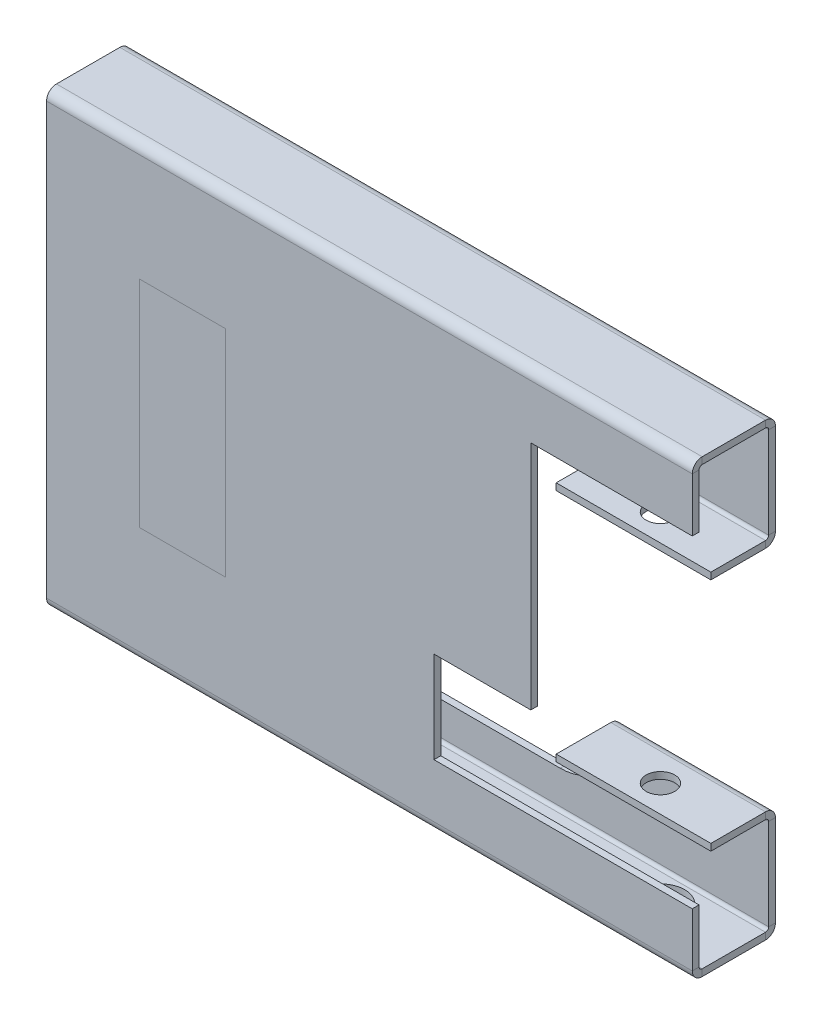
from build123d import *

# Parameters (mm, degrees)
SKETCH1_W                      = 152.4
SKETCH1_H                      = 101.6
BASE_FLANGE1_DEPTH             = 1.6002
EDGE_FLANGE1_DEPTH             = 152.4
EDGE_FLANGE2_DEPTH             = 152.4
CUT_EXTRUDE1_DEPTH             = 95.949783169
EDGE_FLANGE7_STRIP_W           = 7.874
EDGE_FLANGE7_STRIP_H           = 1.6002
EDGE_FLANGE7_STRIP_CUT_DEPTH   = 152.4
EDGE_FLANGE7_DEPTH             = 152.4
EDGE_FLANGE8_STRIP_W           = 7.874
EDGE_FLANGE8_STRIP_H           = 1.6002
EDGE_FLANGE8_STRIP_CUT_DEPTH   = 152.4
EDGE_FLANGE8_DEPTH             = 152.4
SKETCH35_W                     = 36.50996
SKETCH35_H                     = 1.6002
BOSS_EXTRUDE1_DEPTH            = 16.0528
EDGE_FLANGE9_STRIP_W           = 7.874
EDGE_FLANGE9_STRIP_H           = 1.6002
EDGE_FLANGE9_STRIP_CUT_DEPTH   = 36.50996
EDGE_FLANGE9_DEPTH             = 36.50996
SKETCH39_W                     = 36.50996
SKETCH39_H                     = 1.6002
BOSS_EXTRUDE2_DEPTH            = 16.0528
EDGE_FLANGE10_STRIP_W          = 7.874
EDGE_FLANGE10_STRIP_H          = 1.6002
EDGE_FLANGE10_STRIP_CUT_DEPTH  = 36.50996
EDGE_FLANGE10_DEPTH            = 36.50996
CUT_EXTRUDE2_REACH             = 114.257
SKETCH43_R                     = 3.37312
CUT_EXTRUDE2_DIRECTION_2_REACH = 114.257
FILLET1_R                      = 12.7
CUT_EXTRUDE3_REACH             = 134.235
SKETCH46_R                     = 5.715


# Sheet-metal steps are written as plain solids
with BuildPart() as part:
    # Sketch1 → Base-Flange1 (new body)
    with BuildSketch(Plane.XY):
        Rectangle(SKETCH1_W, SKETCH1_H)
    extrude(amount=-BASE_FLANGE1_DEPTH)

    # Edge-Flange1 section (across the edge) → Edge-Flange1 (add)
    with BuildSketch(Plane(origin=(-76.2, 51.5366, -1.6002), x_dir=(0, -1, 0), z_dir=(1, 0, 0))):
        with BuildLine():
            Line((-1.6002, 0.7366), (-1.6002, 18.034))
            Line((-1.6002, 18.034), (0, 18.034))
            Line((0, 18.034), (0, 0.7366))
            ThreePointArc((0, 0.7366), (0.215745145, 0.215745145), (0.7366, 0))
            Line((0.7366, 0), (0.7366, -1.6002))
            ThreePointArc((0.7366, -1.6002), (-0.915767126, -0.915767126), (-1.6002, 0.7366))
        make_face()
    extrude(amount=EDGE_FLANGE1_DEPTH)

    # Edge-Flange2 section (across the edge) → Edge-Flange2 (add)
    with BuildSketch(Plane(origin=(76.2, -51.5366, -1.6002), x_dir=(0, 1, 0), z_dir=(-1, 0, 0))):
        with BuildLine():
            Line((-1.6002, 0.7366), (-1.6002, 18.034))
            Line((-1.6002, 18.034), (0, 18.034))
            Line((0, 18.034), (0, 0.7366))
            ThreePointArc((0, 0.7366), (0.215745145, 0.215745145), (0.7366, 0))
            Line((0.7366, 0), (0.7366, -1.6002))
            ThreePointArc((0.7366, -1.6002), (-0.915767126, -0.915767126), (-1.6002, 0.7366))
        make_face()
    extrude(amount=EDGE_FLANGE2_DEPTH)

    # Sketch14 → Cut-Extrude1 (cut, through all)
    with BuildSketch(Plane.XY):
        Polygon((76.2, -38.1), (76.2, 38.1), (38.1, 38.1), (38.1, -16.51), (15.24, -16.51), (15.24, -38.1), align=None)
    extrude(amount=-CUT_EXTRUDE1_DEPTH, mode=Mode.SUBTRACT)

    # Edge-Flange7 strip (across the edge) → Edge-Flange7 strip cut (cut)
    with BuildSketch(Plane(origin=(76.2, -51.5366, -19.6342), x_dir=(0, 0, 1), z_dir=(-1, 0, 0))):
        with Locations((-1.6002, -0.8001)):
            Rectangle(EDGE_FLANGE7_STRIP_W, EDGE_FLANGE7_STRIP_H)
    extrude(amount=EDGE_FLANGE7_STRIP_CUT_DEPTH, mode=Mode.SUBTRACT)

    # Edge-Flange7 section (across the edge) → Edge-Flange7 (add)
    with BuildSketch(Plane(origin=(76.2, -51.5366, -19.6342), x_dir=(0, 0, 1), z_dir=(-1, 0, 0))):
        with BuildLine():
            Line((0, 0.7366), (0, 8.5598))
            Line((0, 8.5598), (1.6002, 8.5598))
            Line((1.6002, 8.5598), (1.6002, 0.7366))
            ThreePointArc((1.6002, 0.7366), (1.815945145, 0.215745145), (2.3368, 0))
            Line((2.3368, 0), (2.3368, -1.6002))
            ThreePointArc((2.3368, -1.6002), (0.684432874, -0.915767126), (0, 0.7366))
        make_face()
    extrude(amount=EDGE_FLANGE7_DEPTH)

    # Edge-Flange8 strip (across the edge) → Edge-Flange8 strip cut (cut)
    with BuildSketch(Plane(origin=(-76.2, 51.5366, -19.6342), x_dir=(0, 0, 1), z_dir=(1, 0, 0))):
        with Locations((-1.6002, -0.8001)):
            Rectangle(EDGE_FLANGE8_STRIP_W, EDGE_FLANGE8_STRIP_H)
    extrude(amount=EDGE_FLANGE8_STRIP_CUT_DEPTH, mode=Mode.SUBTRACT)

    # Edge-Flange8 section (across the edge) → Edge-Flange8 (add)
    with BuildSketch(Plane(origin=(-76.2, 51.5366, -19.6342), x_dir=(0, 0, 1), z_dir=(1, 0, 0))):
        with BuildLine():
            Line((0, 0.7366), (0, 8.5598))
            Line((0, 8.5598), (1.6002, 8.5598))
            Line((1.6002, 8.5598), (1.6002, 0.7366))
            ThreePointArc((1.6002, 0.7366), (1.815945145, 0.215745145), (2.3368, 0))
            Line((2.3368, 0), (2.3368, -1.6002))
            ThreePointArc((2.3368, -1.6002), (0.684432874, -0.915767126), (0, 0.7366))
        make_face()
    extrude(amount=EDGE_FLANGE8_DEPTH)

    # Sketch35 → Boss-Extrude1 (add)
    with BuildSketch(Plane(origin=(0, -42.9768, 0), x_dir=(1, 0, 0), z_dir=(0, 1, 0))):
        with Locations((57.94502, 18.8341)):
            Rectangle(SKETCH35_W, SKETCH35_H)
    extrude(amount=BOSS_EXTRUDE1_DEPTH)

    # Edge-Flange9 strip (across the edge) → Edge-Flange9 strip cut (cut)
    with BuildSketch(Plane(origin=(76.2, -26.924, -18.034), x_dir=(0, -1, 0), z_dir=(-1, 0, 0))):
        with Locations((-1.6002, -0.8001)):
            Rectangle(EDGE_FLANGE9_STRIP_W, EDGE_FLANGE9_STRIP_H)
    extrude(amount=EDGE_FLANGE9_STRIP_CUT_DEPTH, mode=Mode.SUBTRACT)

    # Edge-Flange9 section (across the edge) → Edge-Flange9 (add)
    with BuildSketch(Plane(origin=(76.2, -26.924, -18.034), x_dir=(0, -1, 0), z_dir=(-1, 0, 0))):
        with BuildLine():
            Line((0, 0.7366), (0, 13.6398))
            Line((0, 13.6398), (1.6002, 13.6398))
            Line((1.6002, 13.6398), (1.6002, 0.7366))
            ThreePointArc((1.6002, 0.7366), (1.815945145, 0.215745145), (2.3368, 0))
            Line((2.3368, 0), (2.3368, -1.6002))
            ThreePointArc((2.3368, -1.6002), (0.684432874, -0.915767126), (0, 0.7366))
        make_face()
    extrude(amount=EDGE_FLANGE9_DEPTH)

    # Sketch39 → Boss-Extrude2 (add)
    with BuildSketch(Plane.XZ.offset(-42.9768)):
        with Locations((57.94502, -18.8341)):
            Rectangle(SKETCH39_W, SKETCH39_H)
    extrude(amount=BOSS_EXTRUDE2_DEPTH)

    # Edge-Flange10 strip (across the edge) → Edge-Flange10 strip cut (cut)
    with BuildSketch(Plane(origin=(39.69004, 26.924, -18.034), x_dir=(0, 1, 0), z_dir=(1, 0, 0))):
        with Locations((-1.6002, -0.8001)):
            Rectangle(EDGE_FLANGE10_STRIP_W, EDGE_FLANGE10_STRIP_H)
    extrude(amount=EDGE_FLANGE10_STRIP_CUT_DEPTH, mode=Mode.SUBTRACT)

    # Edge-Flange10 section (across the edge) → Edge-Flange10 (add)
    with BuildSketch(Plane(origin=(39.69004, 26.924, -18.034), x_dir=(0, 1, 0), z_dir=(1, 0, 0))):
        with BuildLine():
            Line((0, 0.7366), (0, 13.6398))
            Line((0, 13.6398), (1.6002, 13.6398))
            Line((1.6002, 13.6398), (1.6002, 0.7366))
            ThreePointArc((1.6002, 0.7366), (1.815945145, 0.215745145), (2.3368, 0))
            Line((2.3368, 0), (2.3368, -1.6002))
            ThreePointArc((2.3368, -1.6002), (0.684432874, -0.915767126), (0, 0.7366))
        make_face()
    extrude(amount=EDGE_FLANGE10_DEPTH)

    # Cut-Extrude2: up to this face of the body (flat: up to its plane)
    cut_extrude2_end = Plane(part.part.faces().sort_by_distance((57.94502, -28.5242, -10.8458))[0])
    # Sketch43 → Cut-Extrude2 (cut, up to the picked face)
    with BuildSketch(Plane(origin=(0, -26.924, 0), x_dir=(1, 0, 0), z_dir=(0, 1, 0)), mode=Mode.PRIVATE) as cut_extrude2_sk1:
        with Locations(Location((57.94502, 10.7442, 0), (0, 0, 270))):
            Circle(SKETCH43_R)
    cut_extrude2_tool1 = split(extrude(cut_extrude2_sk1.sketch, amount=-CUT_EXTRUDE2_REACH, mode=Mode.PRIVATE), bisect_by=cut_extrude2_end, keep=Keep.BOTH, mode=Mode.PRIVATE)
    add(cut_extrude2_tool1.solids().sort_by(Axis((57.94502, -26.924, -10.7442), (0, -1, 0)))[0], mode=Mode.SUBTRACT)

    # Cut-Extrude2 direction 2: up to this face of the body (flat: up to its plane)
    cut_extrude2_direction_2_end = Plane(part.part.faces().sort_by_distance((57.94502, 28.5242, -10.8458))[0])
    # Sketch43 → Cut-Extrude2 direction 2 (cut, up to the picked face)
    with BuildSketch(Plane(origin=(0, -26.924, 0), x_dir=(1, 0, 0), z_dir=(0, 1, 0)), mode=Mode.PRIVATE) as cut_extrude2_direction_2_sk1:
        with Locations(Location((57.94502, 10.7442, 0), (0, 0, 270))):
            Circle(SKETCH43_R)
    cut_extrude2_direction_2_tool1 = split(extrude(cut_extrude2_direction_2_sk1.sketch, amount=CUT_EXTRUDE2_DIRECTION_2_REACH, mode=Mode.PRIVATE), bisect_by=cut_extrude2_direction_2_end, keep=Keep.BOTH, mode=Mode.PRIVATE)
    add(cut_extrude2_direction_2_tool1.solids().sort_by(Axis((57.94502, -26.924, -10.7442), (0, 1, 0)))[0], mode=Mode.SUBTRACT)

    # Fillet1
    fillet1_edges = [part.edges().sort_by_distance(p)[0] for p in [
        (39.69004, -42.9768, -18.8341),
        (39.69004, 42.9768, -18.8341),
    ]]
    fillet(fillet1_edges, radius=FILLET1_R)

    # Sketch46 → Cut-Extrude3 (cut, up to next)
    with BuildSketch(Plane.XZ.offset(53.1368), mode=Mode.PRIVATE) as cut_extrude3_sk1:
        with Locations(Location((57.94502, -10.7442, 0), (0, 0, 270))):
            Circle(SKETCH46_R)
    cut_extrude3_tool1 = extrude(cut_extrude3_sk1.sketch, amount=-CUT_EXTRUDE3_REACH, mode=Mode.PRIVATE) & part.part
    add(cut_extrude3_tool1.solids().sort_by_distance((57.94502, -53.1368, -10.7442))[0], mode=Mode.SUBTRACT)


solid = part.part
